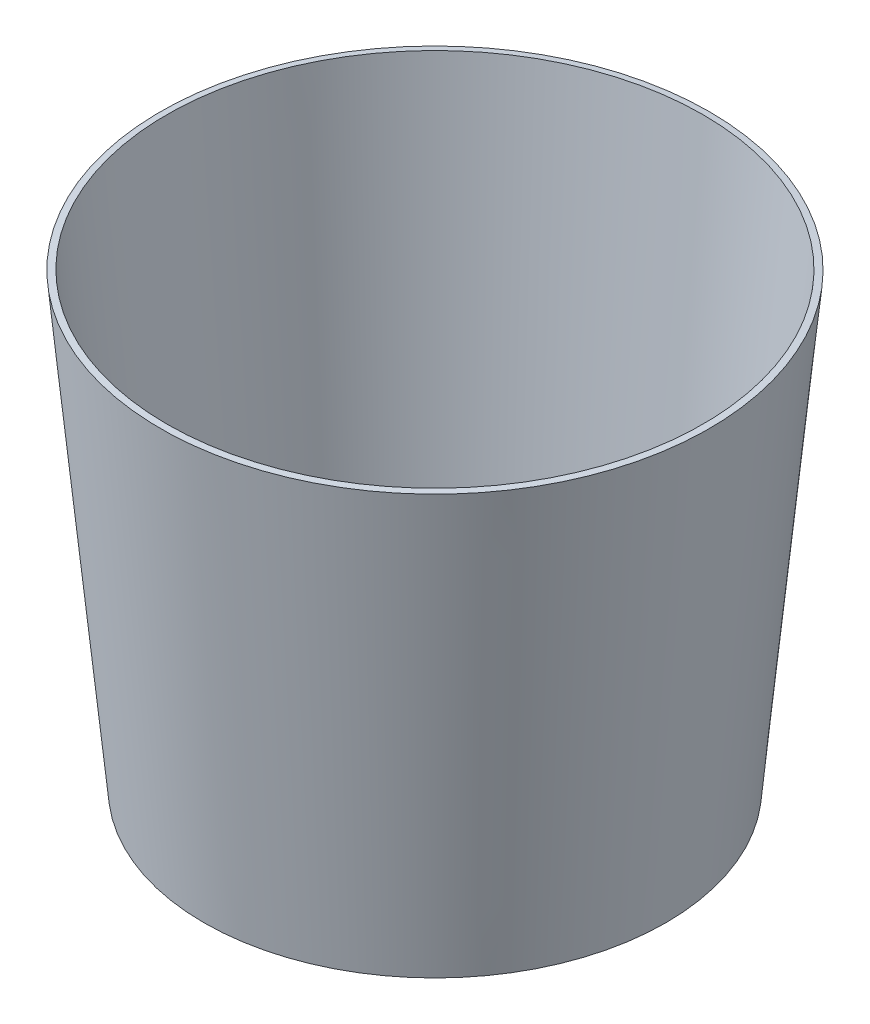
from build123d import *


with BuildPart() as part:
    # 草圖1 → 旋轉1 (revolve)
    with BuildSketch(Plane.XY):
        Polygon((0, 0), (107.724115061, 0), (127.98609462, 209.711488442), (125, 210), (105, 3), (0, 3), align=None)
    revolve(axis=Axis((0, 0, 0), (0, 1, 0)))


solid = part.part
